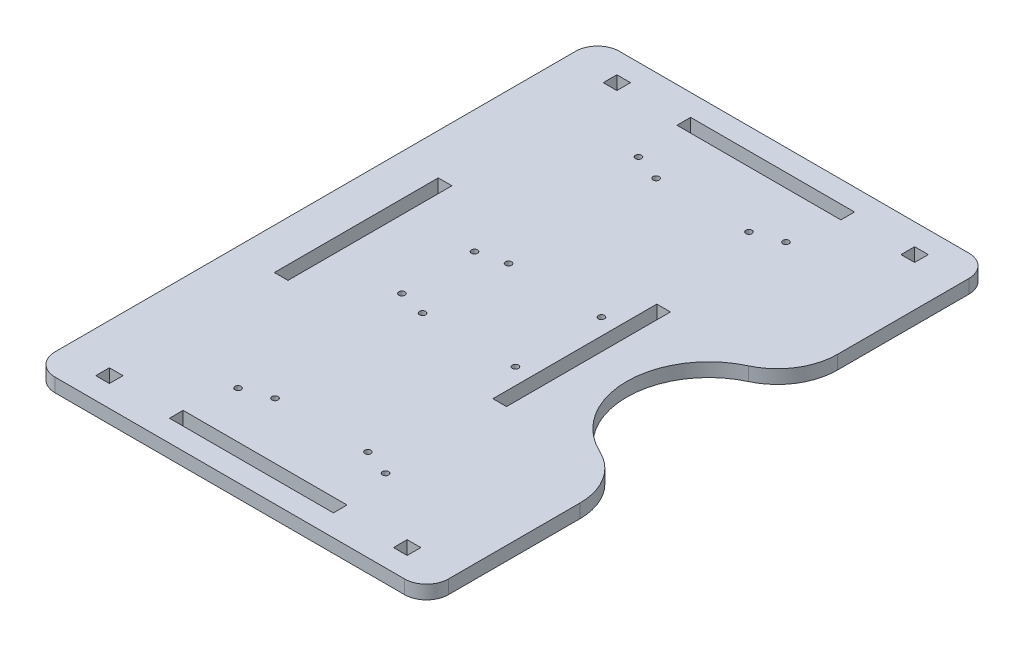
from build123d import *

# Parameters (mm, degrees)
SKETCH3_R           = 1.4224
SKETCH3_W           = 6.35
SKETCH3_H           = 6.35
SKETCH3_W_2         = 76.2
SKETCH3_H_2         = 76.2
BOSS_EXTRUDE1_DEPTH = 6.35
FILLET1_R           = 10.16
FILLET2_R           = 27.94


with BuildPart() as part:
    # Sketch3 → Boss-Extrude1 (new body)
    with BuildSketch(Plane(origin=(0, 0, 0), x_dir=(1, 0, 0), z_dir=(0, 1, 0))):
        with BuildLine():
            Line((182.88, 0), (0, 0))
            Line((0, 0), (0, 262.339276313))
            Line((0, 262.339276313), (182.88, 262.339276313))
            Line((182.88, 262.339276313), (182.88, 169.269638157))
            ThreePointArc((182.88, 169.269638157), (144.78, 131.169638157), (182.88, 93.069638157))
            Line((182.88, 93.069638157), (182.88, 0))
        make_face()
        with Locations((57.15, 38.1)):
            Circle(SKETCH3_R, mode=Mode.SUBTRACT)
        with Locations((57.15, 114.3)):
            Circle(SKETCH3_R, mode=Mode.SUBTRACT)
        with Locations((125.73, 38.1)):
            Circle(SKETCH3_R, mode=Mode.SUBTRACT)
        with Locations((69.85, 151.157668748)):
            Circle(SKETCH3_R, mode=Mode.SUBTRACT)
        with Locations((69.85, 219.737668748)):
            Circle(SKETCH3_R, mode=Mode.SUBTRACT)
        with Locations((113.03, 151.157668748)):
            Circle(SKETCH3_R, mode=Mode.SUBTRACT)
        with Locations((113.03, 219.737668748)):
            Circle(SKETCH3_R, mode=Mode.SUBTRACT)
        with Locations((113.03, 42.601607565)):
            Circle(SKETCH3_R, mode=Mode.SUBTRACT)
        with Locations((113.03, 111.181607565)):
            Circle(SKETCH3_R, mode=Mode.SUBTRACT)
        with Locations((69.85, 111.181607565)):
            Circle(SKETCH3_R, mode=Mode.SUBTRACT)
        with Locations((69.85, 42.601607565)):
            Circle(SKETCH3_R, mode=Mode.SUBTRACT)
        with Locations((125.73, 224.239276313)):
            Circle(SKETCH3_R, mode=Mode.SUBTRACT)
        with Locations((57.15, 224.239276313)):
            Circle(SKETCH3_R, mode=Mode.SUBTRACT)
        with Locations((57.15, 148.039276313)):
            Circle(SKETCH3_R, mode=Mode.SUBTRACT)
        with Locations((22.225, 13.212735966)):
            Rectangle(SKETCH3_W, SKETCH3_H, mode=Mode.SUBTRACT)
        with Locations((160.655, 13.212735966)):
            Rectangle(SKETCH3_W, SKETCH3_H, mode=Mode.SUBTRACT)
        with Locations((160.655, 249.126540348)):
            Rectangle(SKETCH3_W, SKETCH3_H, mode=Mode.SUBTRACT)
        with Locations((22.225, 249.126540348)):
            Rectangle(SKETCH3_W, SKETCH3_H, mode=Mode.SUBTRACT)
        with Locations((91.44, 249.126540348)):
            Rectangle(SKETCH3_W_2, SKETCH3_H, mode=Mode.SUBTRACT)
        with Locations((91.44, 13.212735966)):
            Rectangle(SKETCH3_W_2, SKETCH3_H, mode=Mode.SUBTRACT)
        with Locations((123.825, 131.169638157)):
            Rectangle(SKETCH3_W, SKETCH3_H_2, mode=Mode.SUBTRACT)
        with Locations((22.225, 131.169638157)):
            Rectangle(SKETCH3_W, SKETCH3_H_2, mode=Mode.SUBTRACT)
    extrude(amount=BOSS_EXTRUDE1_DEPTH)

    # Fillet1
    fillet1_edges = [part.edges().sort_by_distance(p)[0] for p in [
        (0, 3.175, 0),
        (0, 3.175, -262.339276313),
        (182.88, 3.175, -262.339276313),
        (182.88, 3.175, 0),
    ]]
    fillet(fillet1_edges, radius=FILLET1_R)

    # Fillet2
    fillet2_edges = [part.edges().sort_by_distance(p)[0] for p in [
        (182.88, 3.175, -169.269638157),
        (182.88, 3.175, -93.069638157),
    ]]
    fillet(fillet2_edges, radius=FILLET2_R)


solid = part.part
